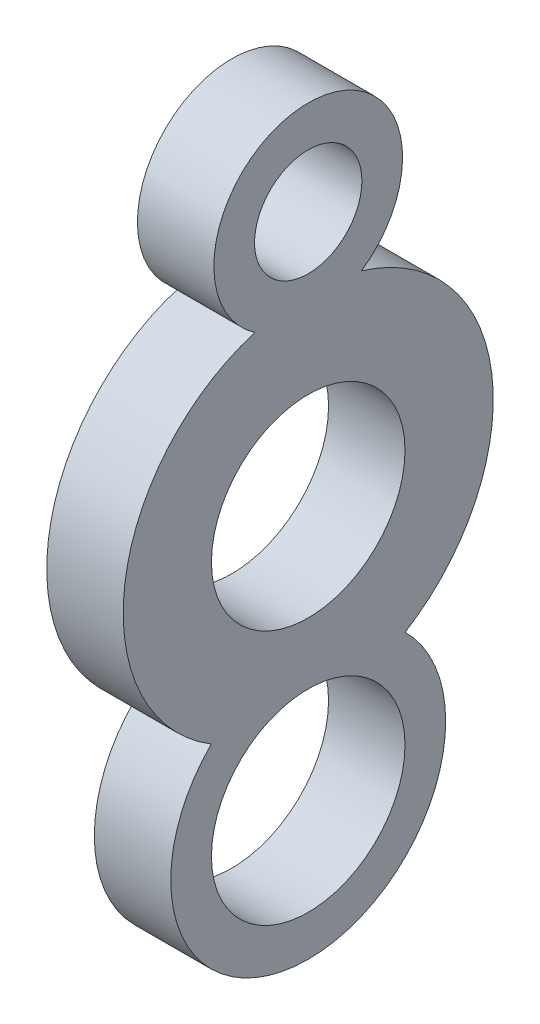
from build123d import *

# Parameters (mm, degrees)
SKETCH1_R           = 16.764
SKETCH1_R_2         = 30.226
BOSS_EXTRUDE1_DEPTH = 23.876


with BuildPart() as part:
    # Sketch1 → Boss-Extrude1 (new body)
    with BuildSketch(Plane(origin=(0, 0, 0), x_dir=(0, 0, -1), z_dir=(1, 0, 0))):
        with BuildLine():
            ThreePointArc((-16.664014609, 55.33007177), (-57.300432946, 7.467704417), (-30.288373804, -49.210980861))
            ThreePointArc((-30.288373804, -49.210980861), (0, -122.555), (30.288373804, -49.210980861))
            ThreePointArc((30.288373804, -49.210980861), (57.300432946, 7.467704417), (16.664014609, 55.33007177))
            ThreePointArc((16.664014609, 55.33007177), (0, 109.093), (-16.664014609, 55.33007177))
        make_face()
        with Locations((0, 79.629)):
            Circle(SKETCH1_R, mode=Mode.SUBTRACT)
        Circle(SKETCH1_R_2, mode=Mode.SUBTRACT)
        with Locations((0, -79.629)):
            Circle(SKETCH1_R_2, mode=Mode.SUBTRACT)
    extrude(amount=BOSS_EXTRUDE1_DEPTH)


solid = part.part
